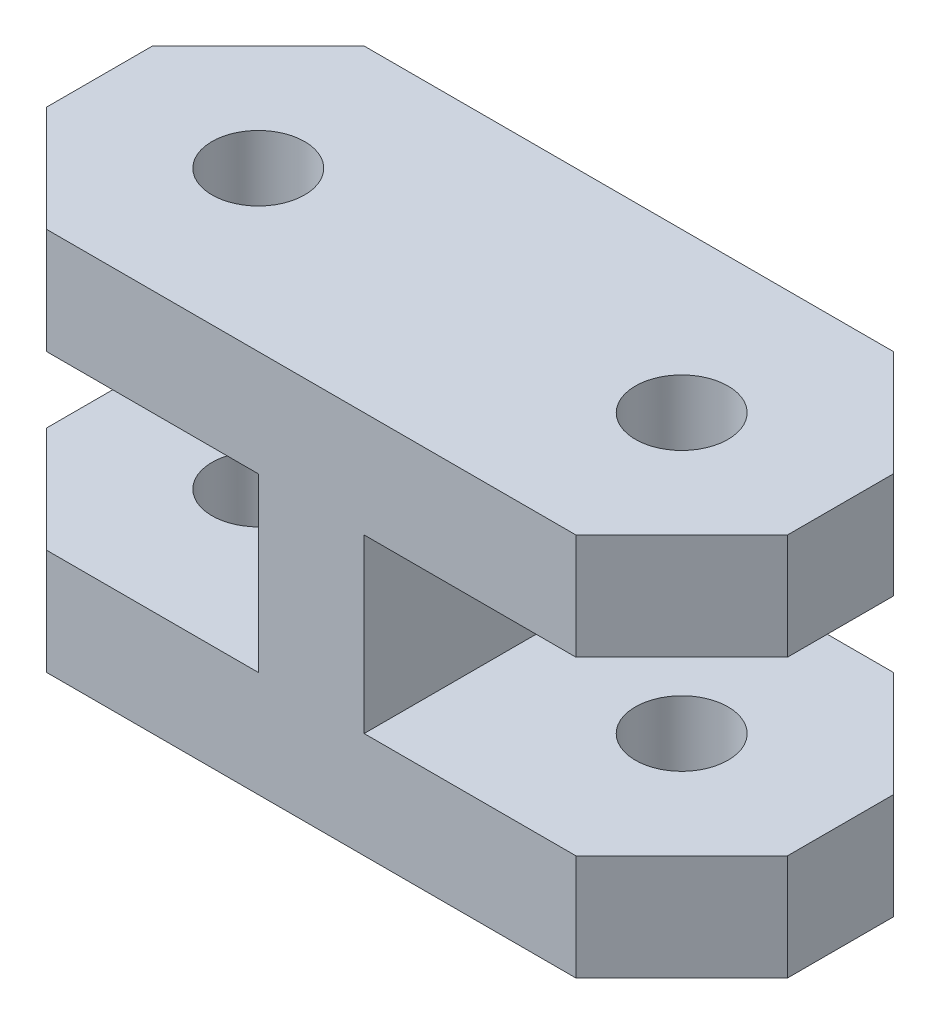
from build123d import *

# Parameters (mm, degrees)
BOSS_EXTRUDE1_DEPTH     = 12
CUT_EXTRUDE1_DEPTH      = 33.221886971
CUT_EXTRUDE1_DEPTH_BACK = 33.221886971
SKETCH2_R               = 1.75
CHAMFER1_SIZE           = 4


with BuildPart() as part:
    # Sketch1 → Boss-Extrude1 (new body)
    with BuildSketch(Plane.XY):
        Polygon((0, 0), (12, 0), (12, -6.5), (0, -6.5), (0, -10.5), (28, -10.5), (28, -6.5), (16, -6.5), (16, 0), (28, 0), (28, 4), (0, 4), align=None)
    extrude(amount=BOSS_EXTRUDE1_DEPTH)

    # Sketch2 → Cut-Extrude1 (cut, two sides: drawn at the far end of the back side and taken through both)
    with BuildSketch(Plane(origin=(0, 0, 0), x_dir=(-1, 0, 0), z_dir=(0, -1, 0)).offset(-CUT_EXTRUDE1_DEPTH_BACK)):
        with Locations((-6, -6)):
            Circle(SKETCH2_R)
        with Locations((-22, -6)):
            Circle(SKETCH2_R)
    extrude(amount=CUT_EXTRUDE1_DEPTH + CUT_EXTRUDE1_DEPTH_BACK, mode=Mode.SUBTRACT)

    # Chamfer1
    chamfer1_edges = [part.edges().sort_by_distance(p)[0] for p in [
        (0, -8.5, 12),
        (0, -8.5, 0),
        (0, 2, 0),
        (0, 2, 12),
        (28, -8.5, 12),
        (28, -8.5, 0),
        (28, 2, 0),
        (28, 2, 12),
    ]]
    chamfer(chamfer1_edges, length=CHAMFER1_SIZE)


solid = part.part
